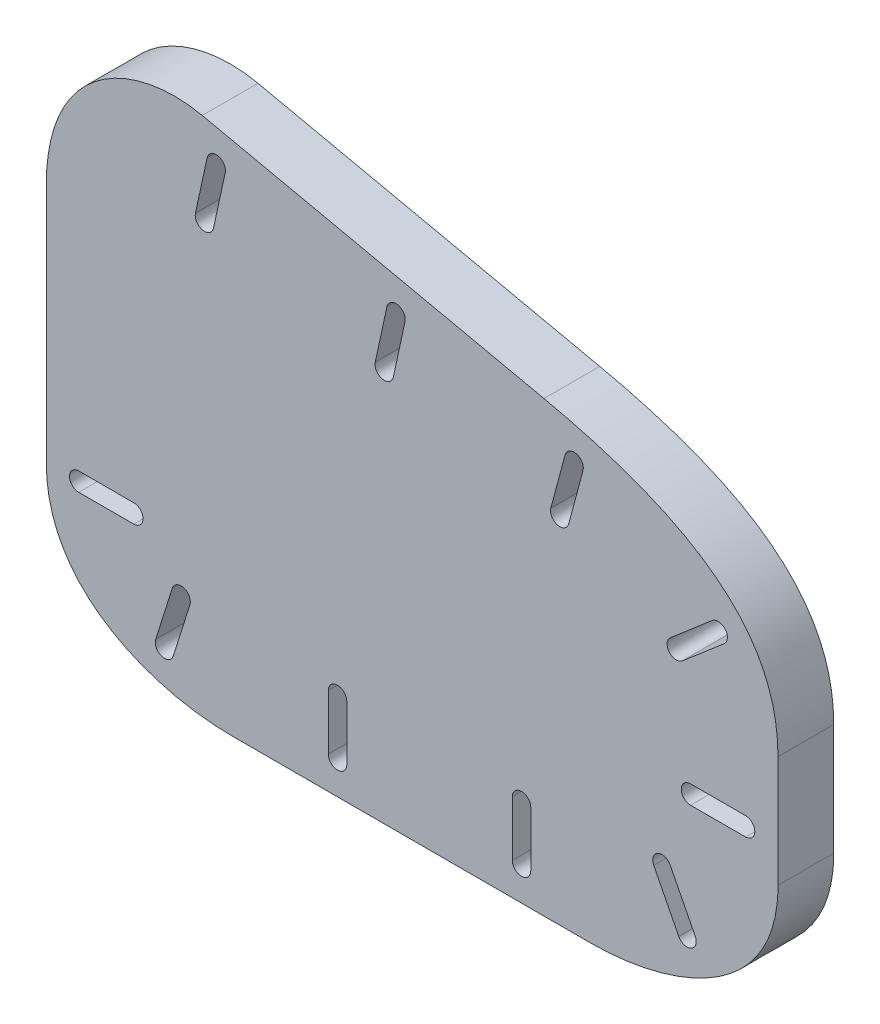
from build123d import *

# Parameters (mm, degrees)
EXTRUDE_1_DEPTH       = 10
CUT_EXTRUDE_1_DEPTH   = 149.427210809
PATTERN_CURVE_1_DEPTH = 10


# Read off the part's stored shape, not the designer's step: Кривая1
with BuildPart() as part:
    # Эскиз1_fr → Бобышка-Вытянуть1 (new body)
    with BuildSketch(Plane.XY):
        with BuildLine():
            Line((0, 0), (0, 20))
            add(Edge.make_bspline(
                [(0, 20), (0, 38.146025899), (-14.209474182, 48.611098897), (-41.986949672, 54.649680525)],
                knots=[0, 0, 0, 0, 1, 1, 1, 1], degree=3))
            Line((-41.986949672, 54.649680525), (-103.301225383, 67.978870897))
            add(Edge.make_bspline(
                [(-103.301225383, 67.978870897), (-115.500001367, 70.63077872), (-131.292525164, 63.393306184), (-131.292525164, 43.097715536)],
                knots=[0, 0, 0, 0, 1, 1, 1, 1], degree=3))
            Line((-131.292525164, 43.097715536), (-131.292525164, 0))
            add(Edge.make_bspline(
                [(-97.969549234, -25.769768053), (-112.011160689, -25.769768053), (-131.292525164, -19.025155818), (-131.292525164, 0)],
                knots=[0, 0, 0, 0, 1, 1, 1, 1], degree=3))
            Line((-97.969549234, -25.769768053), (-33.545129103, -25.769768053))
            add(Edge.make_bspline(
                [(-33.545129103, -25.769768053), (-19.444866568, -25.769768053), (0, -19.063757455), (0, 0)],
                knots=[0, 0, 0, 0, 1, 1, 1, 1], degree=3))
        make_face()
    extrude(amount=EXTRUDE_1_DEPTH)

    # Эскиз2_fr → Вырез-Вытянуть1 (cut, through all)
    with BuildSketch(Plane(origin=(0, 0, 0), x_dir=(-1, 0, 0), z_dir=(0, 0, -1))):
        with BuildLine():
            Line((102.429251955, 61.832882372), (104.527789693, 52.179608775))
            ThreePointArc((104.527789693, 52.179608775), (103.259303337, 50.206407776), (101.286102339, 51.474894133))
            Line((101.286102339, 51.474894133), (99.1875646, 61.128167729))
            ThreePointArc((99.1875646, 61.128167729), (100.456050956, 63.101368728), (102.429251955, 61.832882372))
        make_face()
    extrude(amount=-CUT_EXTRUDE_1_DEPTH, mode=Mode.SUBTRACT)

    # Кривая1 outline → Кривая1 (cut)
    with BuildSketch(Plane.XY):
        with BuildLine():
            ThreePointArc((-66.925496948, 54.114674761), (-68.193983304, 56.08787576), (-70.167184303, 54.819389404))
            Line((-70.167184303, 54.819389404), (-72.265722041, 45.166115807))
            ThreePointArc((-72.265722041, 45.166115807), (-70.997235685, 43.192914809), (-69.024034687, 44.461401165))
            Line((-69.024034687, 44.461401165), (-66.925496948, 54.114674761))
        make_face()
        with BuildLine():
            ThreePointArc((-34.992445024, 46.929960503), (-36.164147849, 48.962124942), (-38.196312288, 47.790422117))
            Line((-38.196312288, 47.790422117), (-40.758641861, 38.249771252))
            ThreePointArc((-40.758641861, 38.249771252), (-39.586939036, 36.217606813), (-37.554774597, 37.389309638))
            Line((-37.554774597, 37.389309638), (-34.992445024, 46.929960503))
        make_face()
        with BuildLine():
            ThreePointArc((-9.659083383, 32.724100966), (-9.478152386, 35.062870683), (-11.816922103, 35.243801681))
            Line((-11.816922103, 35.243801681), (-19.320224464, 28.818071725))
            ThreePointArc((-19.320224464, 28.818071725), (-19.501155461, 26.479302007), (-17.162385743, 26.298371011))
            Line((-17.162385743, 26.298371011), (-9.659083383, 32.724100966))
        make_face()
        with BuildLine():
            ThreePointArc((-5.820481715, 4.607864038), (-4.161780443, 6.266565309), (-5.820481715, 7.925266581))
            Line((-5.820481715, 7.925266581), (-15.699224133, 7.925266581))
            ThreePointArc((-15.699224133, 7.925266581), (-17.357925405, 6.266565309), (-15.699224133, 4.607864038))
            Line((-15.699224133, 4.607864038), (-5.820481715, 4.607864038))
        make_face()
        with BuildLine():
            ThreePointArc((-17.811005152, -16.834920175), (-15.579870133, -17.559224215), (-14.855566092, -15.328089196))
            Line((-14.855566092, -15.328089196), (-19.342689651, -6.527221402))
            ThreePointArc((-19.342689651, -6.527221402), (-21.573824671, -5.802917361), (-22.298128711, -8.034052381))
            Line((-22.298128711, -8.034052381), (-17.811005152, -16.834920175))
        make_face()
        with BuildLine():
            ThreePointArc((-47.67905304, -19.949286338), (-46.020351768, -21.607987609), (-44.361650497, -19.949286338))
            Line((-44.361650497, -19.949286338), (-44.361650497, -10.070543919))
            ThreePointArc((-44.361650497, -10.070543919), (-46.020351768, -8.411842648), (-47.67905304, -10.070543919))
            Line((-47.67905304, -10.070543919), (-47.67905304, -19.949286338))
        make_face()
        with BuildLine():
            ThreePointArc((-80.694656818, -19.949286338), (-79.035955546, -21.607987609), (-77.377254274, -19.949286338))
            Line((-77.377254274, -19.949286338), (-77.377254274, -10.070543919))
            ThreePointArc((-77.377254274, -10.070543919), (-79.035955546, -8.411842648), (-80.694656818, -10.070543919))
            Line((-80.694656818, -10.070543919), (-80.694656818, -19.949286338))
        make_face()
        with BuildLine():
            ThreePointArc((-111.662441641, -17.601639491), (-110.581423079, -19.683460493), (-108.499602077, -18.602441931))
            Line((-108.499602077, -18.602441931), (-105.519357928, -9.18396559))
            ThreePointArc((-105.519357928, -9.18396559), (-106.60037649, -7.102144588), (-108.682197492, -8.18316315))
            Line((-108.682197492, -8.18316315), (-111.662441641, -17.601639491))
        make_face()
        with BuildLine():
            ThreePointArc((-125.472043449, 1.658701272), (-127.130744721, 0), (-125.472043449, -1.658701272))
            Line((-125.472043449, -1.658701272), (-115.593301031, -1.658701272))
            ThreePointArc((-115.593301031, -1.658701272), (-113.934599759, 0), (-115.593301031, 1.658701272))
            Line((-115.593301031, 1.658701272), (-125.472043449, 1.658701272))
        make_face()
    extrude(amount=PATTERN_CURVE_1_DEPTH, mode=Mode.SUBTRACT)


solid = part.part
